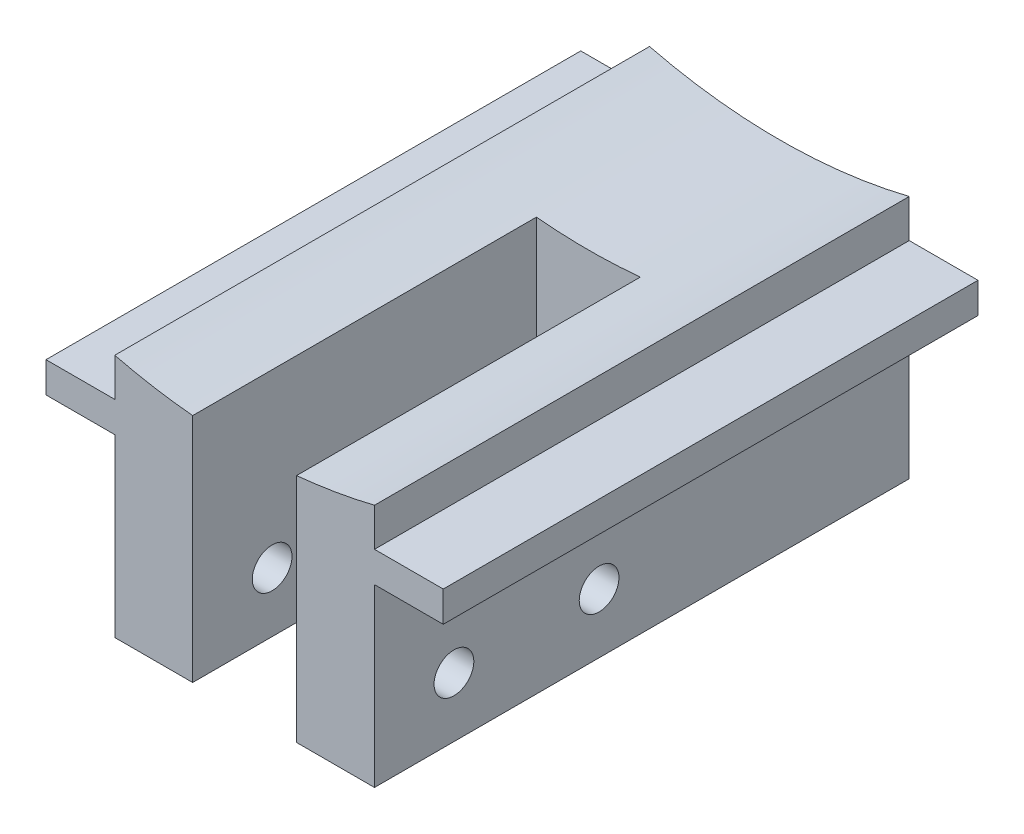
from build123d import *

# Parameters (mm, degrees)
EXTRUDE_1_DEPTH     = 35
CUT_EXTRUDE_1_DEPTH = 22.5
SKETCH_5_R          = 1.3
CUT_EXTRUDE_3_DEPTH = 40.724048132
SKETCH_6_W          = 4.5
SKETCH_6_H          = 2
EXTRUDE_2_DEPTH     = 35


with BuildPart() as part:
    # 草圖2 → 填料-伸長1 (new body)
    with BuildSketch(Plane.XY):
        with BuildLine():
            Line((-8.5, -8), (8.5, -8))
            Line((8.5, -8), (8.5, 8))
            ThreePointArc((8.5, 8), (0, 6.967375879), (-8.5, 8))
            Line((-8.5, 8), (-8.5, -8))
        make_face()
    extrude(amount=-EXTRUDE_1_DEPTH)

    # 草圖3 → 除料-伸長1 (cut)
    with BuildSketch(Plane.XY):
        with BuildLine():
            Line((-3.4, -8), (3.4, -8))
            Line((3.4, -8), (3.4, 7.130567874))
            ThreePointArc((3.4, 7.130567874), (0, 6.967375879), (-3.4, 7.130567874))
            Line((-3.4, 7.130567874), (-3.4, -8))
        make_face()
    extrude(amount=-CUT_EXTRUDE_1_DEPTH, mode=Mode.SUBTRACT)

    # 草圖5 → 除料-伸長3 (cut, through all)
    with BuildSketch(Plane.ZY.offset(8.5)):
        with Locations((-5.2, -4.1)):
            Circle(SKETCH_5_R)
        with Locations((-14.7, -4.1)):
            Circle(SKETCH_5_R)
    extrude(amount=-CUT_EXTRUDE_3_DEPTH, mode=Mode.SUBTRACT)

    # 草圖6 → 填料-伸長2 (add)
    with BuildSketch(Plane.XY):
        with Locations((10.75, 4.5)):
            Rectangle(SKETCH_6_W, SKETCH_6_H)
    extrude_2 = extrude(amount=-EXTRUDE_2_DEPTH)

    # 鏡射1: 填料-伸長2 across plane
    add(extrude_2.mirror(Plane(origin=(0, 0, 0), x_dir=(0, 0, 1), z_dir=(1, 0, 0))))


solid = part.part
